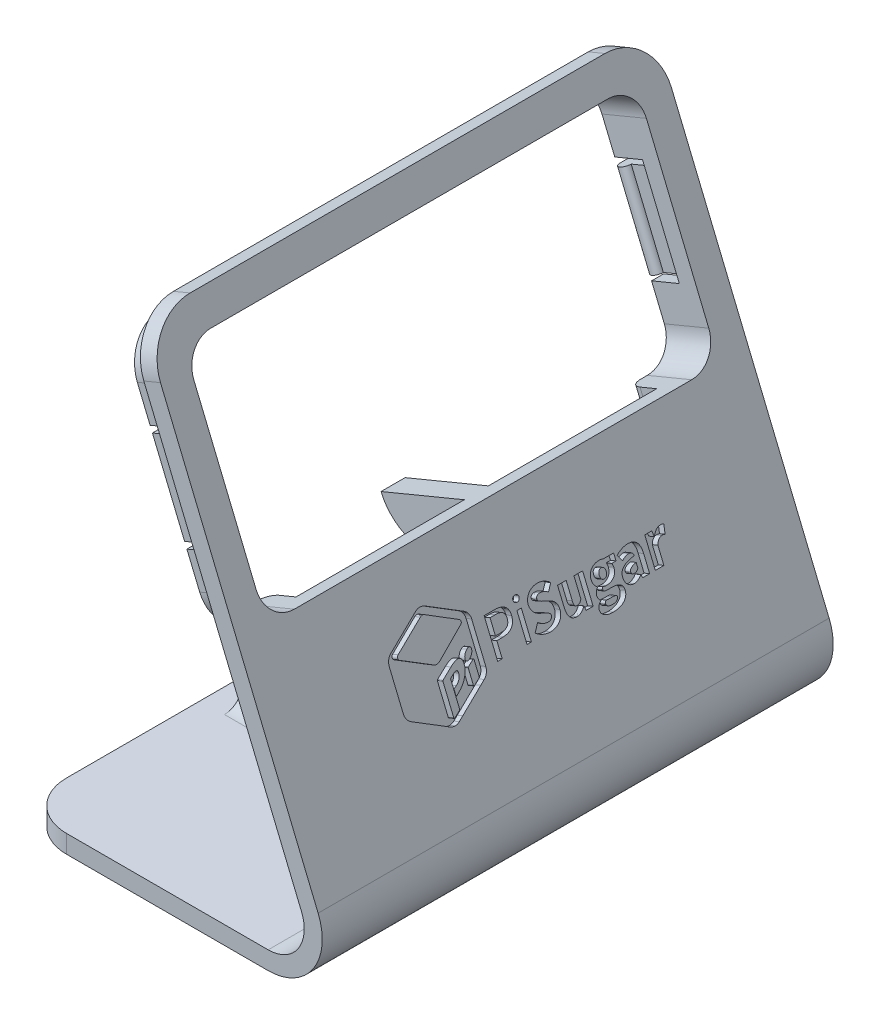
from build123d import *

# Parameters (mm, degrees)
EXTRUDE_1_DEPTH         = 85
FILLET_1_R              = 6
FILLET_2_R              = 9
FILLET_3_R              = 8
SKETCH_2_W              = 75.3
SKETCH_2_H              = 36.3
CUT_EXTRUDE_1_DEPTH     = 3
FILLET_4_R              = 4.6
EXTRUDE_START           = 5
EXTRUDE_3_DEPTH         = 5
SKETCH_5_W              = 60
SKETCH_5_H              = 2
CUT_EXTRUDE_2_DEPTH     = 5
FILLET_5_R              = 2
SKETCH_6_W              = 4
SKETCH_6_H              = 8
EXTRUDE_4_DEPTH         = 15
FILLET_6_R              = 8
SKETCH_7_W              = 2
SKETCH_7_H              = 16
CUT_EXTRUDE_3_DEPTH     = 5
SKETCH_8_W              = 1.5
SKETCH_8_H              = 14
SKETCH_8_W_2            = 1.497401464
EXTRUDE_5_DEPTH         = 5
SKETCH_9_R              = 1
EXTRUDE_6_DEPTH         = 14
CUT_EXTRUDE_START       = -1
CUT_EXTRUDE_4_OUTLINE_W = 0.73350715
CUT_EXTRUDE_4_OUTLINE_H = 4.379975541
CUT_EXTRUDE_4_DEPTH     = 1
SKETCH_11_W             = 8
SKETCH_11_H             = 20
EXTRUDE_7_DEPTH         = 6
SKETCH_12_W             = 16
SKETCH_12_H             = 4
CUT_EXTRUDE_5_DEPTH     = 8
FILLET_7_R              = 6
FILLET_8_R              = 7
SKETCH_13_W             = 3.5
SKETCH_13_H             = 2
CUT_EXTRUDE_6_DEPTH     = 8
FILLET_9_R              = 1
FILLET_10_R             = 3
SKETCH_14_W             = 30
SKETCH_14_H             = 4
CUT_EXTRUDE_7_DEPTH     = 1
FILLET_11_R             = 2


# Read off the part's stored shape, not the designer's step: 切除-拉伸4
# Some blends are built 0.0001 mm under size
with BuildPart() as part:
    # 草图1 → 凸台-拉伸1 (new body)
    with BuildSketch(Plane.XY):
        Polygon((12.85820808, 63.110277036), (45.583834278, -15.889722964), (-4.926203788, -15.889722964), (-4.926203788, -18.889722964), (50.073796212, -18.889722964), (15.629812507, 64.258409826), align=None)
    extrude(amount=-EXTRUDE_1_DEPTH)

    # 圆角1
    fillet_1_edges = [part.edges().sort_by_distance(p)[0] for p in [
        (45.583834278, -15.889722964, -42.5),
    ]]
    fillet(fillet_1_edges, radius=FILLET_1_R)

    # 圆角2
    fillet_2_edges = [part.edges().sort_by_distance(p)[0] for p in [
        (50.073796212, -18.889722964, -42.5),
    ]]
    fillet(fillet_2_edges, radius=FILLET_2_R)

    # 圆角3
    fillet_3_edges = [part.edges().sort_by_distance(p)[0] for p in [
        (-4.926203788, -17.389722964, -85),
        (14.244010293, 63.684343431, -85),
        (-4.926203788, -17.389722964, 0),
        (14.244010293, 63.684343431, 0),
    ]]
    fillet(fillet_3_edges, radius=FILLET_3_R)

    # 草图2 → 切除-拉伸1 (cut)
    with BuildSketch(Plane(origin=(36.060681513, 14.938080805, 0), x_dir=(0, 0, -1), z_dir=(0.9238681421131546, 0.3827109300613039, 0))):
        with Locations((42.5, 30.03459762)):
            Rectangle(SKETCH_2_W, SKETCH_2_H)
    extrude(amount=-CUT_EXTRUDE_1_DEPTH, mode=Mode.SUBTRACT)

    # 圆角4
    fillet_4_edges = [part.edges().sort_by_distance(p)[0] for p in [
        (16.23410713, 58.880229092, -4.85),
        (16.23410713, 58.880229092, -80.15),
        (30.126513891, 25.343815533, -80.15),
        (30.126513891, 25.343815533, -4.85),
    ]]
    fillet(fillet_4_edges, radius=FILLET_4_R)

    # 草图4 → 凸台-拉伸3 (add)
    with BuildSketch(Plane(origin=(33.289077086, 13.789948015, 0), x_dir=(0, 0, 1), z_dir=(-0.9238681421131544, -0.38271093006130386, 0)).offset(EXTRUDE_START)):
        with BuildLine():
            Line((-2.85, 16.48459762), (-2.85, 43.58459762))
            ThreePointArc((-2.85, 43.58459762), (-4.783095244, 48.251502376), (-9.45, 50.18459762))
            Line((-9.45, 50.18459762), (-75.55, 50.18459762))
            ThreePointArc((-75.55, 50.18459762), (-80.216904756, 48.251502376), (-82.15, 43.58459762))
            Line((-82.15, 43.58459762), (-82.15, 16.48459762))
            ThreePointArc((-82.15, 16.48459762), (-80.216904756, 11.817692864), (-75.55, 9.88459762))
            Line((-75.55, 9.88459762), (-9.45, 9.88459762))
            ThreePointArc((-9.45, 9.88459762), (-4.783095244, 11.817692864), (-2.85, 16.48459762))
        make_face()
        with BuildLine():
            Line((-4.85, 43.58459762), (-4.85, 16.48459762))
            ThreePointArc((-4.85, 16.48459762), (-6.197308807, 13.231906426), (-9.45, 11.88459762))
            Line((-9.45, 11.88459762), (-75.55, 11.88459762))
            ThreePointArc((-75.55, 11.88459762), (-78.802691193, 13.231906426), (-80.15, 16.48459762))
            Line((-80.15, 16.48459762), (-80.15, 43.58459762))
            ThreePointArc((-80.15, 43.58459762), (-78.802691193, 46.837288813), (-75.55, 48.18459762))
            Line((-75.55, 48.18459762), (-9.45, 48.18459762))
            ThreePointArc((-9.45, 48.18459762), (-6.197308807, 46.837288813), (-4.85, 43.58459762))
        make_face(mode=Mode.SUBTRACT)
    extrude(amount=-EXTRUDE_3_DEPTH)

    # 草图5 → 切除-拉伸2 (cut)
    with BuildSketch(Plane(origin=(28.669736376, 11.876393365, 0), x_dir=(0, 0, 1), z_dir=(-0.9238681421131545, -0.3827109300613039, 0))):
        with Locations((-42.5, 10.88459762)):
            Rectangle(SKETCH_5_W, SKETCH_5_H)
    extrude(amount=-CUT_EXTRUDE_2_DEPTH, mode=Mode.SUBTRACT)

    # 圆角5
    fillet_5_edges = [part.edges().sort_by_distance(p)[0] for p in [
        (24.504081897, 21.932326346, -72.5),
        (24.504081897, 21.932326346, -12.5),
    ]]
    fillet(fillet_5_edges, radius=FILLET_5_R)

    # 草图6 → 凸台-拉伸4 (add)
    with BuildSketch(Plane(origin=(33.289077086, 13.789948015, 0), x_dir=(0, 0, 1), z_dir=(-0.9238681421131544, -0.38271093006130386, 0))):
        with Locations((-42.5, 7.88459762)):
            Rectangle(SKETCH_6_W, SKETCH_6_H)
    extrude(amount=EXTRUDE_4_DEPTH)

    # 圆角6
    fillet_6_edges = [part.edges().sort_by_distance(p)[0] for p in [
        (17.944376987, 11.63814005, -42.5),
    ]]
    fillet(fillet_6_edges, radius=FILLET_6_R - 0.0001)  # a hair under: the kernel refuses the full size

    # 草图7 → 切除-拉伸3 (cut)
    with BuildSketch(Plane(origin=(28.669736376, 11.876393365, 0), x_dir=(0, 0, 1), z_dir=(-0.9238681421131545, -0.3827109300613039, 0))):
        with Locations((-81.15, 30.03459762)):
            Rectangle(SKETCH_7_W, SKETCH_7_H)
        with Locations((-3.85, 30.03459762)):
            Rectangle(SKETCH_7_W, SKETCH_7_H)
    extrude(amount=-CUT_EXTRUDE_3_DEPTH, mode=Mode.SUBTRACT)

    # 草图8 → 凸台-拉伸5 (add)
    with BuildSketch(Plane(origin=(33.289077086, 13.789948015, 0), x_dir=(0, 0, 1), z_dir=(-0.9238681421131544, -0.38271093006130386, 0))):
        with Locations((-81.4, 30.03459762)):
            Rectangle(SKETCH_8_W, SKETCH_8_H)
        with Locations((-3.598700732, 30.03459762)):
            Rectangle(SKETCH_8_W_2, SKETCH_8_H)
    extrude(amount=EXTRUDE_5_DEPTH)

    # 草图9 → 凸台-拉伸6 (add)
    with BuildSketch(Plane(origin=(-14.1735453, 34.215084897, 0), x_dir=(0.9238681421131544, 0.38271093006130386, 0), z_dir=(-0.3827109300613039, 0.9238681421131545, 0))):
        with Locations((32.032281631, 80.65)):
            Circle(SKETCH_9_R)
        with Locations((32.032281631, 4.35)):
            Circle(SKETCH_9_R)
    extrude(amount=-EXTRUDE_6_DEPTH)

    # 切除-拉伸4 outline → 切除-拉伸4 (cut)
    # profile 1 of 9: a face of its own
    with BuildSketch(Plane(origin=(36.060681513, 14.938080805, 0), x_dir=(0, 0, -1), z_dir=(0.9238681421131546, 0.3827109300613039, 0)).offset(CUT_EXTRUDE_START)):
        with BuildLine():
            Line((36.871120782, -4.476674338), (37.850737236, -4.476674338))
            add(Edge.make_bspline(
                [(37.850737236, -4.476674338), (39.138068579, -4.476674338), (40.025339262, -3.892016049), (40.025339262, -2.645692488)],
                knots=[5, 5, 5, 5, 6, 6, 6, 6], degree=3))
            add(Edge.make_bspline(
                [(40.025339262, -2.645692488), (40.025339262, -1.35325865), (39.138068579, -0.912190208), (37.809666846, -0.912190208)],
                knots=[6, 6, 6, 6, 7, 7, 7, 7], degree=3))
            Line((37.809666846, -0.912190208), (36.122274843, -0.912190208))
            Line((36.122274843, -0.912190208), (36.122274843, -6.820535205))
            Line((36.122274843, -6.820535205), (36.871120782, -6.820535205))
            Line((36.871120782, -6.820535205), (36.871120782, -4.476674338))
        make_face()
        with BuildLine():
            add(Edge.make_bspline(
                [(39.281689729, -2.645692488), (39.281689729, -1.789193294), (38.758543114, -1.517383693), (37.722517481, -1.517383693)],
                knots=[3, 3, 3, 3, 4, 4, 4, 4], degree=3))
            add(Edge.make_bspline(
                [(37.753320274, -3.871480854), (38.794417098, -3.871480854), (39.281689729, -3.491955389), (39.281689729, -2.645692488)],
                knots=[4, 4, 4, 4, 5, 5, 5, 5], degree=3))
            Line((37.753320274, -3.871480854), (36.871120782, -3.871480854))
            Line((36.871120782, -3.871480854), (36.871120782, -1.517383693))
            Line((36.871120782, -1.517383693), (37.722517481, -1.517383693))
        make_face(mode=Mode.SUBTRACT)
    # profile 2 of 9: a face of its own
    with BuildSketch(Plane(origin=(36.060681513, 14.938080805, 0), x_dir=(0, 0, -1), z_dir=(0.9238681421131546, 0.3827109300613039, 0)).offset(CUT_EXTRUDE_START)):
        with BuildLine():
            add(Edge.make_bspline(
                [(41.363945985, -1.537887584), (41.656259478, -1.537887584), (41.871691204, -1.337857254), (41.871691204, -1.066047653), (41.871691204, -0.763435259), (41.656259478, -0.589073923), (41.363945985, -0.589073923)],
                knots=[2, 2, 2, 2, 3, 3, 3, 4, 4, 4, 4], degree=3))
            add(Edge.make_bspline(
                [(41.363945985, -0.589073923), (41.071632492, -0.589073923), (40.856200766, -0.763435259), (40.856200766, -1.066047653), (40.856200766, -1.337857254), (41.071632492, -1.537887584), (41.363945985, -1.537887584)],
                knots=[0, 0, 0, 0, 1, 1, 1, 2, 2, 2, 2], degree=3))
        make_face()
    # profile 3 of 9: a face of its own
    with BuildSketch(Plane(origin=(36.060681513, 14.938080805, 0), x_dir=(0, 0, -1), z_dir=(0.9238681421131546, 0.3827109300613039, 0)).offset(CUT_EXTRUDE_START)):
        with BuildLine():
            Line((45.964455748, -3.40990852), (45.215672416, -3.112429925))
            add(Edge.make_bspline(
                [(45.215672416, -3.112429925), (44.687392002, -2.902131997), (44.307866538, -2.773912243), (44.307866538, -2.440559664)],
                knots=[1, 1, 1, 1, 2, 2, 2, 2], degree=3))
            add(Edge.make_bspline(
                [(44.307866538, -2.440559664), (44.307866538, -2.122577177), (44.579707443, -1.943050739), (45.025909684, -1.943050739)],
                knots=[2, 2, 2, 2, 3, 3, 3, 3], degree=3))
            add(Edge.make_bspline(
                [(45.025909684, -1.943050739), (45.492584513, -1.943050739), (45.861904987, -2.102041982), (46.256769241, -2.404654376)],
                knots=[3, 3, 3, 3, 4, 4, 4, 4], degree=3))
            Line((46.256769241, -2.404654376), (46.974874994, -1.501982296))
            add(Edge.make_bspline(
                [(46.974874994, -1.501982296), (46.451728379, -0.973733186), (45.718283836, -0.70702608), (45.025909684, -0.70702608)],
                knots=[5, 5, 5, 5, 6, 6, 6, 6], degree=3))
            add(Edge.make_bspline(
                [(45.025909684, -0.70702608), (43.748845939, -0.70702608), (42.846173859, -1.517383693), (42.846173859, -2.522606533)],
                knots=[6, 6, 6, 6, 7, 7, 7, 7], degree=3))
            add(Edge.make_bspline(
                [(42.846173859, -2.522606533), (42.846173859, -3.394507124), (43.435934644, -3.917653739), (44.066828425, -4.168959449)],
                knots=[7, 7, 7, 7, 8, 8, 8, 8], degree=3))
            Line((44.066828425, -4.168959449), (44.831013153, -4.492075734))
            add(Edge.make_bspline(
                [(44.831013153, -4.492075734), (45.343892171, -4.707476157), (45.677276054, -4.820325818), (45.677276054, -5.169079794)],
                knots=[9, 9, 9, 9, 10, 10, 10, 10], degree=3))
            add(Edge.make_bspline(
                [(45.677276054, -5.169079794), (45.677276054, -5.492196079), (45.425970344, -5.692195105), (44.892556131, -5.692195105)],
                knots=[10, 10, 10, 10, 11, 11, 11, 11], degree=3))
            add(Edge.make_bspline(
                [(44.892556131, -5.692195105), (44.420747503, -5.692195105), (43.861664297, -5.440889395), (43.435934644, -5.076765327)],
                knots=[11, 11, 11, 11, 12, 12, 12, 12], degree=3))
            Line((43.435934644, -5.076765327), (42.620537143, -6.071751874))
            add(Edge.make_bspline(
                [(42.620537143, -6.071751874), (43.24110072, -6.64104007), (44.082167214, -6.933384867), (44.861753338, -6.933384867)],
                knots=[13, 13, 13, 13, 14, 14, 14, 14], degree=3))
            add(Edge.make_bspline(
                [(44.861753338, -6.933384867), (46.313241027, -6.933384867), (47.154307522, -6.056350477), (47.154307522, -5.056230132)],
                knots=[14, 14, 14, 14, 15, 15, 15, 15], degree=3))
            add(Edge.make_bspline(
                [(47.154307522, -5.056230132), (47.154307522, -4.209998535), (46.708167888, -3.707355811), (45.964455748, -3.40990852)],
                knots=[15, 15, 15, 15, 16, 16, 16, 16], degree=3))
        make_face()
    # profile 4 of 9: a face of its own
    with BuildSketch(Plane(origin=(36.060681513, 14.938080805, 0), x_dir=(0, 0, -1), z_dir=(0.9238681421131546, 0.3827109300613039, 0)).offset(CUT_EXTRUDE_START)):
        with BuildLine():
            Line((50.559894319, -2.235395535), (50.559894319, -5.240890369))
            add(Edge.make_bspline(
                [(50.559894319, -5.240890369), (50.318856206, -5.579376747), (50.118763269, -5.707596502), (49.795709591, -5.707596502)],
                knots=[1, 1, 1, 1, 2, 2, 2, 2], degree=3))
            add(Edge.make_bspline(
                [(49.795709591, -5.707596502), (49.431522916, -5.707596502), (49.262295378, -5.528101367), (49.262295378, -4.89210509)],
                knots=[2, 2, 2, 2, 3, 3, 3, 3], degree=3))
            Line((49.262295378, -4.89210509), (49.262295378, -2.235395535))
            Line((49.262295378, -2.235395535), (47.831342885, -2.235395535))
            Line((47.831342885, -2.235395535), (47.831342885, -5.071631528))
            add(Edge.make_bspline(
                [(47.831342885, -5.071631528), (47.831342885, -6.215341721), (48.257072538, -6.933384867), (49.25716158, -6.933384867)],
                knots=[6, 6, 6, 6, 7, 7, 7, 7], degree=3))
            add(Edge.make_bspline(
                [(49.25716158, -6.933384867), (49.882858955, -6.933384867), (50.313722408, -6.64104007), (50.693247872, -6.18970403)],
                knots=[7, 7, 7, 7, 8, 8, 8, 8], degree=3))
            Line((50.693247872, -6.18970403), (50.723988057, -6.18970403))
            Line((50.723988057, -6.18970403), (50.826601425, -6.820535205))
            Line((50.826601425, -6.820535205), (51.995918004, -6.820535205))
            Line((51.995918004, -6.820535205), (51.995918004, -2.235395535))
            Line((51.995918004, -2.235395535), (50.559894319, -2.235395535))
        make_face()
    # profile 5 of 9: a face of its own
    with BuildSketch(Plane(origin=(36.060681513, 14.938080805, 0), x_dir=(0, 0, -1), z_dir=(0.9238681421131546, 0.3827109300613039, 0)).offset(CUT_EXTRUDE_START)):
        with BuildLine():
            Line((65.258961887, -3.450916303), (65.5, -2.214891644))
            add(Edge.make_bspline(
                [(65.5, -2.214891644), (65.371780246, -2.158482465), (65.217954105, -2.122577177), (64.9461132, -2.122577177)],
                knots=[10, 10, 10, 10, 11, 11, 11, 11], degree=3))
            add(Edge.make_bspline(
                [(64.9461132, -2.122577177), (64.484509562, -2.122577177), (63.976764343, -2.420055772), (63.638309269, -3.030351752)],
                knots=[0, 0, 0, 0, 1, 1, 1, 1], degree=3))
            Line((63.638309269, -3.030351752), (63.607506476, -3.030351752))
            Line((63.607506476, -3.030351752), (63.510089515, -2.235395535))
            Line((63.510089515, -2.235395535), (62.340710329, -2.235395535))
            Line((62.340710329, -2.235395535), (62.340710329, -6.820535205))
            Line((62.340710329, -6.820535205), (63.766529023, -6.820535205))
            Line((63.766529023, -6.820535205), (63.766529023, -4.199730938))
            add(Edge.make_bspline(
                [(63.766529023, -4.199730938), (64.007567136, -3.594537453), (64.417895393, -3.379137031), (64.756350467, -3.379137031)],
                knots=[7, 7, 7, 7, 8, 8, 8, 8], degree=3))
            add(Edge.make_bspline(
                [(64.756350467, -3.379137031), (64.961514596, -3.379137031), (65.094868149, -3.40990852), (65.258961887, -3.450916303)],
                knots=[8, 8, 8, 8, 9, 9, 9, 9], degree=3))
        make_face()
    # profile 6 of 9: a face of its own
    with BuildSketch(Plane(origin=(36.060681513, 14.938080805, 0), x_dir=(0, 0, -1), z_dir=(0.9238681421131546, 0.3827109300613039, 0)).offset(CUT_EXTRUDE_START)):
        with BuildLine():
            Line((61.396967859, -6.820535205), (61.396967859, -4.215132334))
            add(Edge.make_bspline(
                [(61.396967859, -4.215132334), (61.396967859, -2.779046042), (60.725128901, -2.122577177), (59.540410927, -2.122577177)],
                knots=[11, 11, 11, 11, 12, 12, 12, 12], degree=3))
            add(Edge.make_bspline(
                [(59.540410927, -2.122577177), (58.827438972, -2.122577177), (58.171001411, -2.363615289), (57.565776623, -2.722636863)],
                knots=[0, 0, 0, 0, 1, 1, 1, 1], degree=3))
            Line((57.565776623, -2.722636863), (58.068388043, -3.666348029))
            add(Edge.make_bspline(
                [(58.068388043, -3.666348029), (58.524920489, -3.40990852), (58.904445953, -3.266287369), (59.268570021, -3.266287369)],
                knots=[2, 2, 2, 2, 3, 3, 3, 3], degree=3))
            add(Edge.make_bspline(
                [(59.268570021, -3.266287369), (59.73524485, -3.266287369), (59.930203989, -3.481687792), (59.960944174, -3.850976962)],
                knots=[3, 3, 3, 3, 4, 4, 4, 4], degree=3))
            add(Edge.make_bspline(
                [(59.960944174, -3.850976962), (58.171001411, -4.045873493), (57.411887874, -4.568988805), (57.411887874, -5.538337661)],
                knots=[4, 4, 4, 4, 5, 5, 5, 5], degree=3))
            add(Edge.make_bspline(
                [(57.411887874, -5.538337661), (57.411887874, -6.302522389), (57.929900691, -6.933384867), (58.776226199, -6.933384867)],
                knots=[5, 5, 5, 5, 6, 6, 6, 6], degree=3))
            add(Edge.make_bspline(
                [(58.776226199, -6.933384867), (59.283971418, -6.933384867), (59.709638464, -6.697449249), (60.089163928, -6.358962871)],
                knots=[6, 6, 6, 6, 7, 7, 7, 7], degree=3))
            Line((60.089163928, -6.358962871), (60.125037912, -6.358962871))
            Line((60.125037912, -6.358962871), (60.227588673, -6.820535205))
            Line((60.227588673, -6.820535205), (61.396967859, -6.820535205))
        make_face()
        with BuildLine():
            add(Edge.make_bspline(
                [(59.268570021, -5.82041486), (59.560883514, -5.82041486), (59.750646246, -5.681958812), (59.960944174, -5.456290792)],
                knots=[0, 0, 0, 0, 1, 1, 1, 1], degree=3))
            add(Edge.make_bspline(
                [(58.776226199, -5.425519303), (58.776226199, -5.692195105), (58.971060122, -5.82041486), (59.268570021, -5.82041486)],
                knots=[1, 1, 1, 1, 2, 2, 2, 2], degree=3))
            add(Edge.make_bspline(
                [(59.960944174, -4.722877553), (59.068539692, -4.845963509), (58.776226199, -5.102403017), (58.776226199, -5.425519303)],
                knots=[2, 2, 2, 2, 3, 3, 3, 3], degree=3))
            Line((59.960944174, -4.722877553), (59.960944174, -5.456290792))
        make_face(mode=Mode.SUBTRACT)
    # profile 7 of 9: a face of its own
    with BuildSketch(Plane(origin=(36.060681513, 14.938080805, 0), x_dir=(0, 0, -1), z_dir=(0.9238681421131546, 0.3827109300613039, 0)).offset(CUT_EXTRUDE_START)):
        with BuildLine():
            Line((55.462985172, -5.917863125), (54.739808227, -5.917863125))
            add(Edge.make_bspline(
                [(54.739808227, -5.917863125), (54.247464404, -5.917863125), (54.062835471, -5.82041486), (54.062835471, -5.610148236)],
                knots=[1, 1, 1, 1, 2, 2, 2, 2], degree=3))
            add(Edge.make_bspline(
                [(54.062835471, -5.610148236), (54.062835471, -5.456290792), (54.098709455, -5.384480216), (54.206394014, -5.287031951)],
                knots=[2, 2, 2, 2, 3, 3, 3, 3], degree=3))
            add(Edge.make_bspline(
                [(54.206394014, -5.287031951), (54.406486951, -5.34344113), (54.591053277, -5.369110124), (54.744942026, -5.369110124)],
                knots=[3, 3, 3, 3, 4, 4, 4, 4], degree=3))
            add(Edge.make_bspline(
                [(54.744942026, -5.369110124), (55.760432463, -5.369110124), (56.575955179, -4.902372688), (56.575955179, -3.830473071)],
                knots=[4, 4, 4, 4, 5, 5, 5, 5], degree=3))
            add(Edge.make_bspline(
                [(56.575955179, -3.830473071), (56.575955179, -3.609907546), (56.519483392, -3.399640922), (56.447735424, -3.271421168)],
                knots=[5, 5, 5, 5, 6, 6, 6, 6], degree=3))
            Line((56.447735424, -3.271421168), (57.155448366, -3.271421168))
            Line((57.155448366, -3.271421168), (57.155448366, -2.235395535))
            Line((57.155448366, -2.235395535), (55.473252769, -2.235395535))
            add(Edge.make_bspline(
                [(55.473252769, -2.235395535), (55.262954842, -2.158482465), (55.011649132, -2.122577177), (54.744942026, -2.122577177)],
                knots=[9, 9, 9, 9, 10, 10, 10, 10], degree=3))
            add(Edge.make_bspline(
                [(54.744942026, -2.122577177), (53.755120582, -2.122577177), (52.826779508, -2.666227683), (52.826779508, -3.789433984)],
                knots=[10, 10, 10, 10, 11, 11, 11, 11], degree=3))
            add(Edge.make_bspline(
                [(52.826779508, -3.789433984), (52.826779508, -4.322816893), (53.124289407, -4.748515243), (53.447343085, -4.974183263)],
                knots=[11, 11, 11, 11, 12, 12, 12, 12], degree=3))
            Line((53.447343085, -4.974183263), (53.447343085, -5.004954752))
            add(Edge.make_bspline(
                [(53.447343085, -5.004954752), (53.149895794, -5.215221375), (52.939597866, -5.538337661), (52.939597866, -5.861453946)],
                knots=[13, 13, 13, 13, 14, 14, 14, 14], degree=3))
            add(Edge.make_bspline(
                [(52.939597866, -5.861453946), (52.939597866, -6.24611321), (53.119155608, -6.487182626), (53.360193721, -6.651307668)],
                knots=[14, 14, 14, 14, 15, 15, 15, 15], degree=3))
            Line((53.360193721, -6.651307668), (53.360193721, -6.692315451))
            add(Edge.make_bspline(
                [(53.360193721, -6.692315451), (52.934464068, -6.907747177), (52.708827351, -7.215462066), (52.708827351, -7.59498753)],
                knots=[16, 16, 16, 16, 17, 17, 17, 17], degree=3))
            add(Edge.make_bspline(
                [(52.708827351, -7.59498753), (52.708827351, -8.415581437), (53.57556284, -8.74896532), (54.632123668, -8.74896532)],
                knots=[17, 17, 17, 17, 18, 18, 18, 18], degree=3))
            add(Edge.make_bspline(
                [(54.632123668, -8.74896532), (56.2271699, -8.74896532), (57.227321548, -8.061724966), (57.227321548, -7.09237611)],
                knots=[18, 18, 18, 18, 19, 19, 19, 19], degree=3))
            add(Edge.make_bspline(
                [(57.227321548, -7.09237611), (57.227321548, -6.261514606), (56.591356575, -5.917863125), (55.462985172, -5.917863125)],
                knots=[19, 19, 19, 19, 20, 20, 20, 20], degree=3))
        make_face()
        with BuildLine():
            add(Edge.make_bspline(
                [(54.857760384, -7.851427039), (55.447646383, -7.851427039), (55.857912033, -7.636026617), (55.857912033, -7.34368182)],
                knots=[5, 5, 5, 5, 6, 6, 6, 6], degree=3))
            add(Edge.make_bspline(
                [(53.883340336, -7.36931951), (53.883340336, -7.692435796), (54.267999599, -7.851427039), (54.857760384, -7.851427039)],
                knots=[0, 0, 0, 0, 1, 1, 1, 1], degree=3))
            add(Edge.make_bspline(
                [(54.098709455, -6.959022557), (53.955088304, -7.087242311), (53.883340336, -7.215462066), (53.883340336, -7.36931951)],
                knots=[1, 1, 1, 1, 2, 2, 2, 2], degree=3))
            add(Edge.make_bspline(
                [(54.755209623, -7.015431736), (54.421888348, -7.015431736), (54.247464404, -7.000061643), (54.098709455, -6.959022557)],
                knots=[2, 2, 2, 2, 3, 3, 3, 3], degree=3))
            Line((54.755209623, -7.015431736), (55.191206874, -7.015431736))
            add(Edge.make_bspline(
                [(55.857912033, -7.34368182), (55.857912033, -7.071840915), (55.616811313, -7.015431736), (55.191206874, -7.015431736)],
                knots=[4, 4, 4, 4, 5, 5, 5, 5], degree=3))
        make_face(mode=Mode.SUBTRACT)
        with BuildLine():
            add(Edge.make_bspline(
                [(54.744942026, -4.507445827), (55.083459707, -4.507445827), (55.32449782, -4.266407714), (55.32449782, -3.789433984), (55.32449782, -3.322696548), (55.083459707, -3.081658436), (54.744942026, -3.081658436)],
                knots=[0, 0, 0, 0, 1, 1, 1, 2, 2, 2, 2], degree=3))
            add(Edge.make_bspline(
                [(54.744942026, -3.081658436), (54.416754549, -3.081658436), (54.165448839, -3.322696548), (54.165448839, -3.789433984), (54.165448839, -4.266407714), (54.416754549, -4.507445827), (54.744942026, -4.507445827)],
                knots=[2, 2, 2, 2, 3, 3, 3, 4, 4, 4, 4], degree=3))
        make_face(mode=Mode.SUBTRACT)
    # profile 8 of 9: a face of its own
    with BuildSketch(Plane(origin=(36.060681513, 14.938080805, 0), x_dir=(0, 0, -1), z_dir=(0.9238681421131546, 0.3827109300613039, 0)).offset(CUT_EXTRUDE_START)):
        with BuildLine():
            Line((28.870220628, 3.493454327), (28.131704894, 3.924286475))
            add(Edge.make_bspline(
                [(28.131704894, 3.924286475), (27.890604174, 4.057608725), (27.623959675, 4.1294193), (27.357252569, 4.1294193)],
                knots=[3, 3, 3, 3, 4, 4, 4, 4], degree=3))
            add(Edge.make_bspline(
                [(27.357252569, 4.1294193), (27.090545463, 4.1294193), (26.823838356, 4.057608725), (26.582800244, 3.924286475)],
                knots=[4, 4, 4, 4, 5, 5, 5, 5], degree=3))
            Line((26.582800244, 3.924286475), (25.844221903, 3.493454327))
            Line((25.844221903, 3.493454327), (22.013030666, 1.282947013))
            Line((22.013030666, 1.282947013), (21.274452325, 0.857248663))
            add(Edge.make_bspline(
                [(21.274452325, 0.857248663), (20.797509899, 0.580305263), (20.5, 0.067426246), (20.5, -0.48135806)],
                knots=[8, 8, 8, 8, 9, 9, 9, 9], degree=3))
            Line((20.5, -0.48135806), (20.5, -6.61540238))
            add(Edge.make_bspline(
                [(20.5, -6.61540238), (20.5, -7.169289181), (20.797509899, -7.677065703), (21.274452325, -7.954009103)],
                knots=[10, 10, 10, 10, 11, 11, 11, 11], degree=3))
            Line((21.274452325, -7.954009103), (22.013030666, -8.379707453))
            Line((22.013030666, -8.379707453), (25.844221903, -10.590214767))
            Line((25.844221903, -10.590214767), (26.582800244, -11.021015612))
            add(Edge.make_bspline(
                [(26.582800244, -11.021015612), (26.823838356, -11.159502964), (27.090545463, -11.22617974), (27.357252569, -11.22617974)],
                knots=[14, 14, 14, 14, 15, 15, 15, 15], degree=3))
            add(Edge.make_bspline(
                [(27.357252569, -11.22617974), (27.623959675, -11.22617974), (27.890604174, -11.159502964), (28.131704894, -11.021015612)],
                knots=[15, 15, 15, 15, 16, 16, 16, 16], degree=3))
            Line((28.131704894, -11.021015612), (28.870220628, -10.590214767))
            Line((28.870220628, -10.590214767), (32.701411864, -8.379707453))
            Line((32.701411864, -8.379707453), (33.439927598, -7.954009103))
            add(Edge.make_bspline(
                [(33.439927598, -7.954009103), (33.922066431, -7.677065703), (34.214379923, -7.169289181), (34.214379923, -6.61540238)],
                knots=[19, 19, 19, 19, 20, 20, 20, 20], degree=3))
            Line((34.214379923, -6.61540238), (34.214379923, -0.48135806))
            add(Edge.make_bspline(
                [(34.214379923, -0.48135806), (34.214379923, 0.067426246), (33.922066431, 0.580305263), (33.439927598, 0.857248663)],
                knots=[21, 21, 21, 21, 22, 22, 22, 22], degree=3))
            Line((33.439927598, 0.857248663), (32.701411864, 1.282947013))
            Line((32.701411864, 1.282947013), (28.870220628, 3.493454327))
        make_face()
        with BuildLine():
            add(Edge.make_bspline(
                [(30.080607597, -5.610148236), (30.080607597, -6.097389564), (29.8036955, -6.528190409), (29.2189433, -6.856440493)],
                knots=[0, 0, 0, 0, 1, 1, 1, 1], degree=3))
            add(Edge.make_bspline(
                [(29.188203115, -5.440889395), (29.76262511, -5.112670615), (30.080607597, -5.107536816), (30.080607597, -5.610148236)],
                knots=[6, 6, 6, 6, 7, 7, 7, 7], degree=3))
            Line((29.188203115, -5.440889395), (28.747134672, -5.68709261))
            add(Edge.make_bspline(
                [(28.695796685, -5.774273278), (28.695796685, -5.738367991), (28.71633188, -5.702462703), (28.747134672, -5.68709261)],
                knots=[4, 4, 4, 4, 5, 5, 5, 5], degree=3))
            Line((28.695796685, -5.774273278), (28.695796685, -9.692676486))
            add(Edge.make_bspline(
                [(28.644583912, -9.779857154), (28.680457896, -9.759353263), (28.695796685, -9.728581774), (28.695796685, -9.692676486)],
                knots=[3, 3, 3, 3, 4, 4, 4, 4], degree=3))
            Line((28.644583912, -9.779857154), (27.649566062, -10.344011552))
            add(Edge.make_bspline(
                [(27.500811112, -10.256830884), (27.500811112, -10.333775258), (27.582889285, -10.37991684), (27.649566062, -10.344011552)],
                knots=[5, 5, 5, 5, 6, 6, 6, 6], degree=3))
            Line((27.500811112, -10.256830884), (27.500811112, -5.507566172))
            add(Edge.make_bspline(
                [(27.552086493, -5.420385504), (27.516212509, -5.435755597), (27.500811112, -5.471660884), (27.500811112, -5.507566172)],
                knots=[7, 7, 7, 7, 8, 8, 8, 8], degree=3))
            Line((27.552086493, -5.420385504), (29.244612294, -4.461304245))
            add(Edge.make_bspline(
                [(31.249924176, -4.948545573), (31.249924176, -3.717623409), (30.342180904, -3.840709365), (29.244612294, -4.461304245)],
                knots=[9, 9, 9, 9, 10, 10, 10, 10], degree=3))
            add(Edge.make_bspline(
                [(29.280548885, -7.76938017), (30.331913307, -7.174422979), (31.249924176, -6.133294851), (31.249924176, -4.948545573)],
                knots=[10, 10, 10, 10, 11, 11, 11, 11], degree=3))
            Line((29.280548885, -7.76938017), (28.747134672, -8.066827461))
            Line((28.747134672, -8.066827461), (28.747134672, -7.09237611))
            Line((28.747134672, -7.09237611), (29.2189433, -6.856440493))
        make_face(mode=Mode.SUBTRACT)
        with BuildLine():
            add(Edge.make_bspline(
                [(32.793695027, -7.451397683), (32.82449782, -7.435996287), (32.845033015, -7.400090999), (32.845033015, -7.364185712)],
                knots=[0, 0, 0, 0, 1, 1, 1, 1], degree=3))
            Line((32.793695027, -7.451397683), (31.809007382, -8.010418282))
            add(Edge.make_bspline(
                [(31.660252433, -7.923237614), (31.660252433, -8.000150685), (31.742330606, -8.04632357), (31.809007382, -8.010418282)],
                knots=[2, 2, 2, 2, 3, 3, 3, 3], degree=3))
            Line((31.660252433, -7.923237614), (31.660252433, -5.661423617))
            add(Edge.make_bspline(
                [(31.71159042, -5.574242949), (31.680787628, -5.59474684), (31.660252433, -5.625549633), (31.660252433, -5.661423617)],
                knots=[4, 4, 4, 4, 5, 5, 5, 5], degree=3))
            Line((31.71159042, -5.574242949), (32.696278065, -5.020324844))
            add(Edge.make_bspline(
                [(32.845033015, -5.107536816), (32.845033015, -5.030592442), (32.762954842, -4.98445086), (32.696278065, -5.020324844)],
                knots=[6, 6, 6, 6, 7, 7, 7, 7], degree=3))
            Line((32.845033015, -5.107536816), (32.845033015, -7.364185712))
        make_face(mode=Mode.SUBTRACT)
        with BuildLine():
            add(Edge.make_bspline(
                [(32.255209623, -3.517593079), (31.855211571, -3.743261099), (31.573103068, -4.153558052), (31.573103068, -4.517713424), (31.573103068, -4.871601199), (31.855211571, -4.969049464), (32.255209623, -4.738247645)],
                knots=[0, 0, 0, 0, 1, 1, 1, 2, 2, 2, 2], degree=3))
            add(Edge.make_bspline(
                [(32.255209623, -4.738247645), (32.650136484, -4.517713424), (32.932182379, -4.102282672), (32.932182379, -3.748394898), (32.932182379, -3.389373325), (32.650136484, -3.291925059), (32.255209623, -3.517593079)],
                knots=[2, 2, 2, 2, 3, 3, 3, 4, 4, 4, 4], degree=3))
        make_face(mode=Mode.SUBTRACT)
        with BuildLine():
            add(Edge.make_bspline(
                [(26.85971234, -3.127800017), (27.167427229, -3.307326456), (27.552086493, -3.307326456), (27.859863989, -3.127800017)],
                knots=[7, 7, 7, 7, 8, 8, 8, 8], degree=3))
            add(Edge.make_bspline(
                [(22.213060996, -0.445452772), (22.223328594, -0.450586571), (26.85971234, -3.127800017)],
                knots=[0, 0, 0, 1, 1, 1], degree=2))
            add(Edge.make_bspline(
                [(22.259202578, 0.24692138), (21.99762927, 0.098197735), (21.972022884, -0.271091436), (22.213060996, -0.445452772)],
                knots=[1, 1, 1, 1, 2, 2, 2, 2], degree=3))
            Line((22.259202578, 0.24692138), (26.998199692, 2.985709108))
            add(Edge.make_bspline(
                [(27.721376637, 2.985709108), (27.495739921, 3.113928863), (27.218765217, 3.113928863), (26.998199692, 2.985709108)],
                knots=[3, 3, 3, 3, 4, 4, 4, 4], degree=3))
            Line((27.721376637, 2.985709108), (32.434704758, 0.241787582))
            add(Edge.make_bspline(
                [(32.439838557, -0.389043593), (32.680876669, -0.245422442), (32.67574287, 0.103331533), (32.434704758, 0.241787582)],
                knots=[5, 5, 5, 5, 6, 6, 6, 6], degree=3))
            Line((32.439838557, -0.389043593), (27.859863989, -3.127800017))
        make_face(mode=Mode.SUBTRACT)
    # profile 9 of 9: a face of its own
    with BuildSketch(Plane(origin=(36.060681513, 14.938080805, 0), x_dir=(0, 0, -1), z_dir=(0.9238681421131546, 0.3827109300613039, 0)).offset(CUT_EXTRUDE_START)):
        with Locations((41.361379086, -4.630547435)):
            Rectangle(CUT_EXTRUDE_4_OUTLINE_W, CUT_EXTRUDE_4_OUTLINE_H)
    extrude(amount=CUT_EXTRUDE_4_DEPTH, mode=Mode.SUBTRACT)

    # 草图11 → 凸台-拉伸7 (add)
    with BuildSketch(Plane(origin=(0, -15.889722964, 0), x_dir=(1, 0, 0), z_dir=(0, 1, 0))):
        with Locations((3.073796212, 42.5)):
            Rectangle(SKETCH_11_W, SKETCH_11_H)
    extrude(amount=EXTRUDE_7_DEPTH)

    # 草图12 → 切除-拉伸5 (cut)
    with BuildSketch(Plane.ZY.offset(0.926203788)):
        with Locations((-42.5, -13.889722964)):
            Rectangle(SKETCH_12_W, SKETCH_12_H)
    extrude(amount=-CUT_EXTRUDE_5_DEPTH, mode=Mode.SUBTRACT)

    # 圆角7
    # the kernel refuses this fillet: 6 mm, written as the material it adds along each edge
    with BuildSketch(Plane(origin=(-0.926203788, -11.889722964, -34.5), x_dir=(0, 0, -1), z_dir=(1, 0, 0))) as fillet_7_piece_1:
        with BuildLine():
            CenterArc((5.656854249, -6), FILLET_7_R, 90, 70.528779366)
            Line((0, -4), (-0.113137085, -3.96))
            ThreePointArc((-0.113137085, -3.96), (-0.12, -2), (-0.12, 0))
            Line((-0.12, 0), (0, 0.12))
            Line((0, 0.12), (5.656854249, 0.12))
            Line((5.656854249, 0.12), (5.656854249, 0))
        make_face()
    extrude(amount=8)
    with BuildSketch(Plane(origin=(-0.926203788, -11.889722964, -50.5), x_dir=(0, -1, 0), z_dir=(1, 0, 0))) as fillet_7_piece_2:
        with BuildLine():
            CenterArc((6, -5.656854249), FILLET_7_R, 109.471220634, 70.528779366)
            Line((0, -5.656854249), (-0.12, -5.656854249))
            Line((-0.12, -5.656854249), (-0.12, 0))
            Line((-0.12, 0), (0, 0.12))
            ThreePointArc((0, 0.12), (2, 0.12), (3.96, 0.113137085))
            Line((3.96, 0.113137085), (4, 0))
        make_face()
    extrude(amount=8)

    # 圆角8
    # the kernel refuses this fillet: 7 mm, written as the material it takes off along each edge
    with BuildSketch(Plane(origin=(-18.246711864, -9.889722964, -32.5), x_dir=(0, -1, 0), z_dir=(1, 0, 0)), Plane(origin=(24.394304288, -9.889722964, -52.5), x_dir=(0, -1, 0), z_dir=(-1, 0, 0))) as fillet_8_piece_1:
        with BuildLine():
            CenterArc((7, 6.92820323), FILLET_8_R, 180, 81.786789298)
            Line((0, 6.92820323), (-0.14, 6.92820323))
            Line((-0.14, 6.92820323), (-0.14, 0))
            Line((-0.14, 0), (0, -0.14))
            ThreePointArc((0, -0.14), (3, -0.14), (5.98, -0.138564065))
            Line((5.98, -0.138564065), (6, 0))
        make_face()
    extrude(amount=42.641016151, mode=Mode.SUBTRACT)

    # 草图13 → 切除-拉伸6 (cut)
    with BuildSketch(Plane.ZY.offset(0.926203788)):
        with Locations((-42.5, -10.889722964)):
            Rectangle(SKETCH_13_W, SKETCH_13_H)
    extrude(amount=-CUT_EXTRUDE_6_DEPTH, mode=Mode.SUBTRACT)

    # 圆角9
    fillet_9_edges = [part.edges().sort_by_distance(p)[0] for p in [
        (3.073796212, -11.889722964, -40.75),
        (3.073796212, -11.889722964, -44.25),
        (3.073796212, -9.889722964, -44.25),
        (3.073796212, -9.889722964, -40.75),
    ]]
    fillet(fillet_9_edges, radius=FILLET_9_R)

    # 圆角10
    # the kernel refuses this fillet: 3 mm, written as the material it adds along each edge
    with BuildSketch(Plane(origin=(-0.926203788, -15.889722964, -32.5), x_dir=(0, 0, 1), z_dir=(1, 0, 0)), Plane(origin=(7.073796212, -15.889722964, -52.5), x_dir=(0, 0, -1), z_dir=(-1, 0, 0))) as fillet_10_piece_1:
        with BuildLine():
            CenterArc((2.23694816, -3), FILLET_10_R, 90, 66.421821522)
            ThreePointArc((-0.512597257, -1.8), (-0.195869979, -0.917208645), (0, 0))
            Line((0, 0), (2.23694816, 0))
        make_face()
    extrude(amount=8)

    # 草图14 → 切除-拉伸7 (cut)
    with BuildSketch(Plane.XZ.offset(18.889722964)):
        with Locations((18.073796212, -5)):
            Rectangle(SKETCH_14_W, SKETCH_14_H)
        with Locations((18.073796212, -80)):
            Rectangle(SKETCH_14_W, SKETCH_14_H)
    extrude(amount=-CUT_EXTRUDE_7_DEPTH, mode=Mode.SUBTRACT)

    # 圆角11
    fillet_11_edges = [part.edges().sort_by_distance(p)[0] for p in [
        (3.073796212, -18.389722964, -82),
        (3.073796212, -18.389722964, -78),
        (33.073796212, -18.389722964, -82),
        (33.073796212, -18.389722964, -78),
        (3.073796212, -18.389722964, -7),
        (3.073796212, -18.389722964, -3),
        (33.073796212, -18.389722964, -7),
        (33.073796212, -18.389722964, -3),
    ]]
    fillet(fillet_11_edges, radius=FILLET_11_R - 0.0001)  # a hair under: the kernel refuses the full size


solid = part.part
